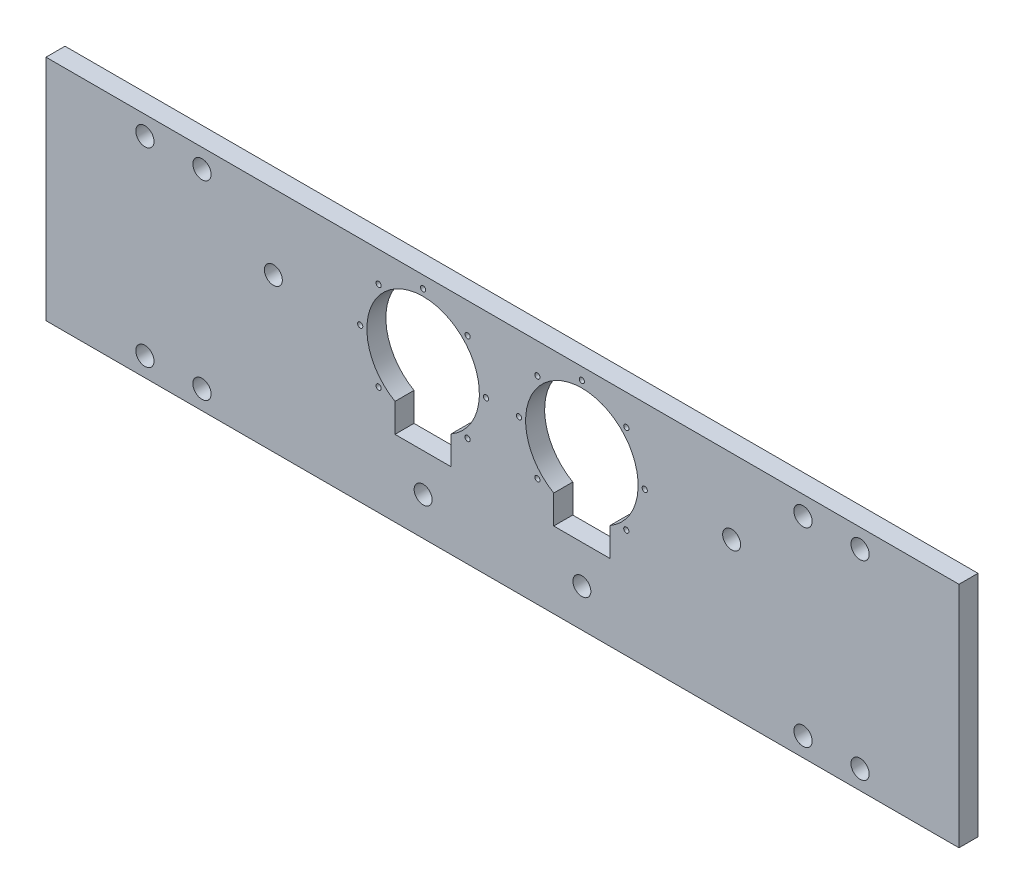
from build123d import *

# Parameters (mm, degrees)
SKETCH1_W           = 609.6
SKETCH1_H           = 152.4
SKETCH1_R           = 1.745996
SKETCH1_R_2         = 1.746
SKETCH1_R_3         = 6.096
SKETCH1_R_4         = 6
BOSS_EXTRUDE1_DEPTH = 12.7


with BuildPart() as part:
    # Sketch1 → Boss-Extrude1 (new body)
    with BuildSketch(Plane.XY):
        Rectangle(SKETCH1_W, SKETCH1_H)
        with Locations((82.698486542, 55.898482492)):
            Circle(SKETCH1_R, mode=Mode.SUBTRACT)
        with Locations((95.00000245, 26.19999595)):
            Circle(SKETCH1_R_2, mode=Mode.SUBTRACT)
        with Locations((82.698486542, -3.498490592)):
            Circle(SKETCH1_R, mode=Mode.SUBTRACT)
        with Locations((23.301513458, -3.498490592)):
            Circle(SKETCH1_R, mode=Mode.SUBTRACT)
        with Locations((10.99999755, 26.19999595)):
            Circle(SKETCH1_R_2, mode=Mode.SUBTRACT)
        with Locations((23.301513458, 55.898482492)):
            Circle(SKETCH1_R, mode=Mode.SUBTRACT)
        with Locations((-53, 68.1999984)):
            Circle(SKETCH1_R, mode=Mode.SUBTRACT)
        with Locations((238.76, 63.5)):
            Circle(SKETCH1_R_3, mode=Mode.SUBTRACT)
        with Locations((200.66, 63.5)):
            Circle(SKETCH1_R_3, mode=Mode.SUBTRACT)
        with Locations((238.76, -63.5)):
            Circle(SKETCH1_R_3, mode=Mode.SUBTRACT)
        with Locations((200.66, -63.5)):
            Circle(SKETCH1_R_3, mode=Mode.SUBTRACT)
        with Locations((-82.698486542, -3.498490592)):
            Circle(SKETCH1_R, mode=Mode.SUBTRACT)
        with Locations((-95.00000245, 26.19999595)):
            Circle(SKETCH1_R_2, mode=Mode.SUBTRACT)
        with Locations((-82.698486542, 55.898482492)):
            Circle(SKETCH1_R, mode=Mode.SUBTRACT)
        with Locations((-23.301513458, 55.898482492)):
            Circle(SKETCH1_R, mode=Mode.SUBTRACT)
        with Locations((-10.99999755, 26.19999595)):
            Circle(SKETCH1_R_2, mode=Mode.SUBTRACT)
        with Locations((-23.301513458, -3.498490592)):
            Circle(SKETCH1_R, mode=Mode.SUBTRACT)
        with Locations((-238.76, 63.5)):
            Circle(SKETCH1_R_3, mode=Mode.SUBTRACT)
        with Locations((-200.66, 63.5)):
            Circle(SKETCH1_R_3, mode=Mode.SUBTRACT)
        with Locations((-200.66, -63.5)):
            Circle(SKETCH1_R_3, mode=Mode.SUBTRACT)
        with Locations((-238.76, -63.5)):
            Circle(SKETCH1_R_3, mode=Mode.SUBTRACT)
        with Locations((53, 68.1999984)):
            Circle(SKETCH1_R, mode=Mode.SUBTRACT)
        with Locations((53, -50.8)):
            Circle(SKETCH1_R_4, mode=Mode.SUBTRACT)
        with Locations((153, 26.199996505)):
            Circle(SKETCH1_R_4, mode=Mode.SUBTRACT)
        with Locations((-153, 26.199996505)):
            Circle(SKETCH1_R_4, mode=Mode.SUBTRACT)
        with Locations((-53, -50.8)):
            Circle(SKETCH1_R_4, mode=Mode.SUBTRACT)
        with BuildLine():
            Line((34.21825, -6.330946855), (34.21825, -25.4))
            Line((34.21825, -25.4), (71.78175, -25.4))
            Line((71.78175, -25.4), (71.78175, -6.330946855))
            ThreePointArc((71.78175, -6.330946855), (53, 63.7634984), (34.21825, -6.330946855))
        make_face(mode=Mode.SUBTRACT)
        with BuildLine():
            Line((-34.21825, -6.330946855), (-34.21825, -25.4))
            Line((-34.21825, -25.4), (-71.78175, -25.4))
            Line((-71.78175, -25.4), (-71.78175, -6.330946855))
            ThreePointArc((-71.78175, -6.330946855), (-53, 63.7634984), (-34.21825, -6.330946855))
        make_face(mode=Mode.SUBTRACT)
    extrude(amount=BOSS_EXTRUDE1_DEPTH)


solid = part.part
